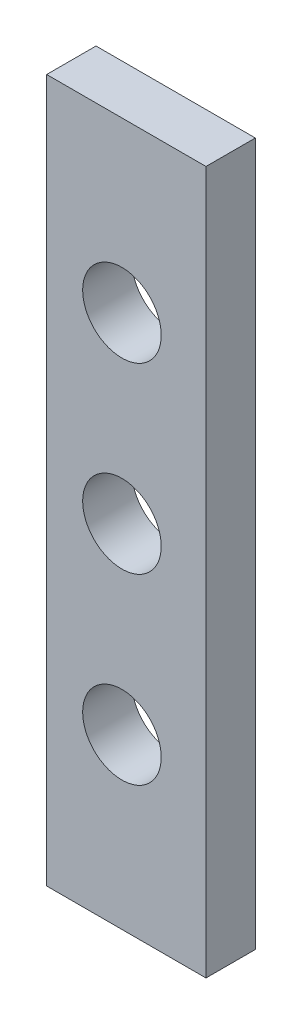
from build123d import *

# Parameters (mm, degrees)
SKETCH_1_W                = 8.718422396
SKETCH_1_H                = 38.462613559
EXTRUDE_1_DEPTH           = 2.7
HOLE_WIZARD_1_D           = 4.3
HOLE_WIZARD_1_DEPTH       = 19
HOLE_WIZARD_1_CSINK_D     = 8
HOLE_WIZARD_1_CSINK_ANGLE = 90
HOLE_WIZARD_1_TIP         = 1.291850331


with BuildPart() as part:
    # 草图1 → 凸台-拉伸1 (new body)
    with BuildSketch(Plane.XY):
        with Locations((-125.640788802, -85.768693221)):
            Rectangle(SKETCH_1_W, SKETCH_1_H)
    extrude(amount=EXTRUDE_1_DEPTH)

    # 打孔尺寸(%根据十字)槽沉头木螺钉的类型1
    with Locations(Plane(origin=(40.491378875, -131.010130877, 7.000000001), x_dir=(0, 1, 0), z_dir=(0, 0, 1))):
        with Locations((35.241437657, 166.37295648), (45.241437657, 166.37295648), (55.241437657, 166.37295648), (206.778824098, 166.37295648), (216.778824098, 166.37295648), (226.778824098, 166.37295648)):
            CounterSinkHole(HOLE_WIZARD_1_D / 2, HOLE_WIZARD_1_CSINK_D / 2, depth=HOLE_WIZARD_1_DEPTH, counter_sink_angle=HOLE_WIZARD_1_CSINK_ANGLE)
            with Locations((0, 0, -(HOLE_WIZARD_1_DEPTH + HOLE_WIZARD_1_TIP / 2))):  # 118° drill point
                Cone(0, HOLE_WIZARD_1_D / 2, HOLE_WIZARD_1_TIP, mode=Mode.SUBTRACT)


solid = part.part
